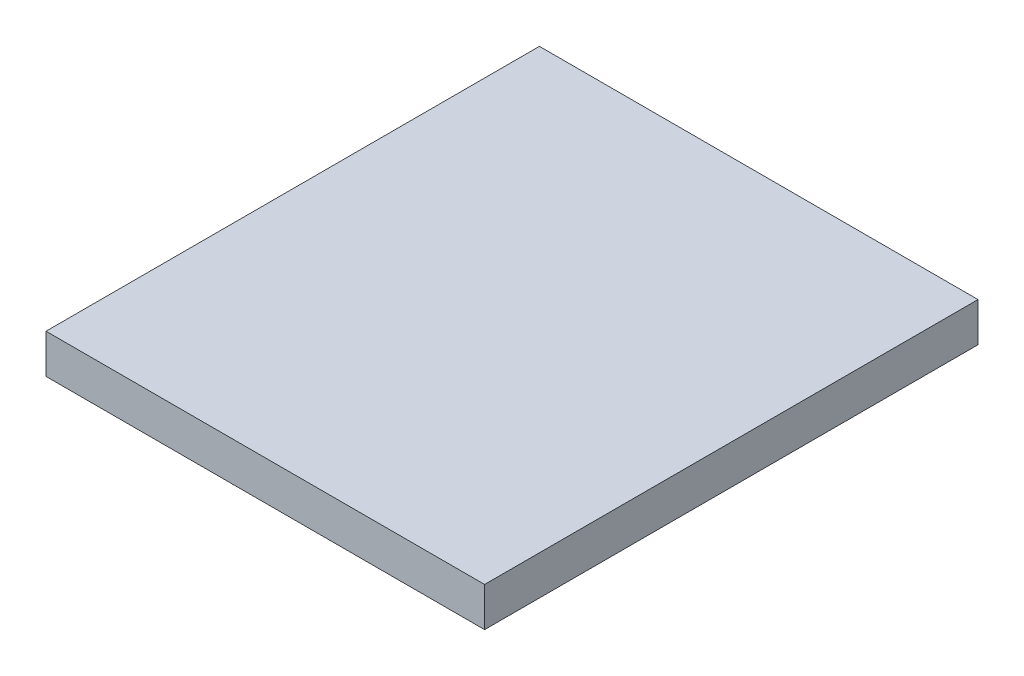
from build123d import *

# Parameters (mm, degrees)
SKETCH1_W           = 355.6
SKETCH1_H           = 400.05
BOSS_EXTRUDE1_DEPTH = 31.75


with BuildPart() as part:
    # Sketch1 → Boss-Extrude1 (new body)
    with BuildSketch(Plane(origin=(0, 0, 0), x_dir=(1, 0, 0), z_dir=(0, 1, 0))):
        with Locations((177.8, 200.025)):
            Rectangle(SKETCH1_W, SKETCH1_H)
    extrude(amount=BOSS_EXTRUDE1_DEPTH)


solid = part.part
